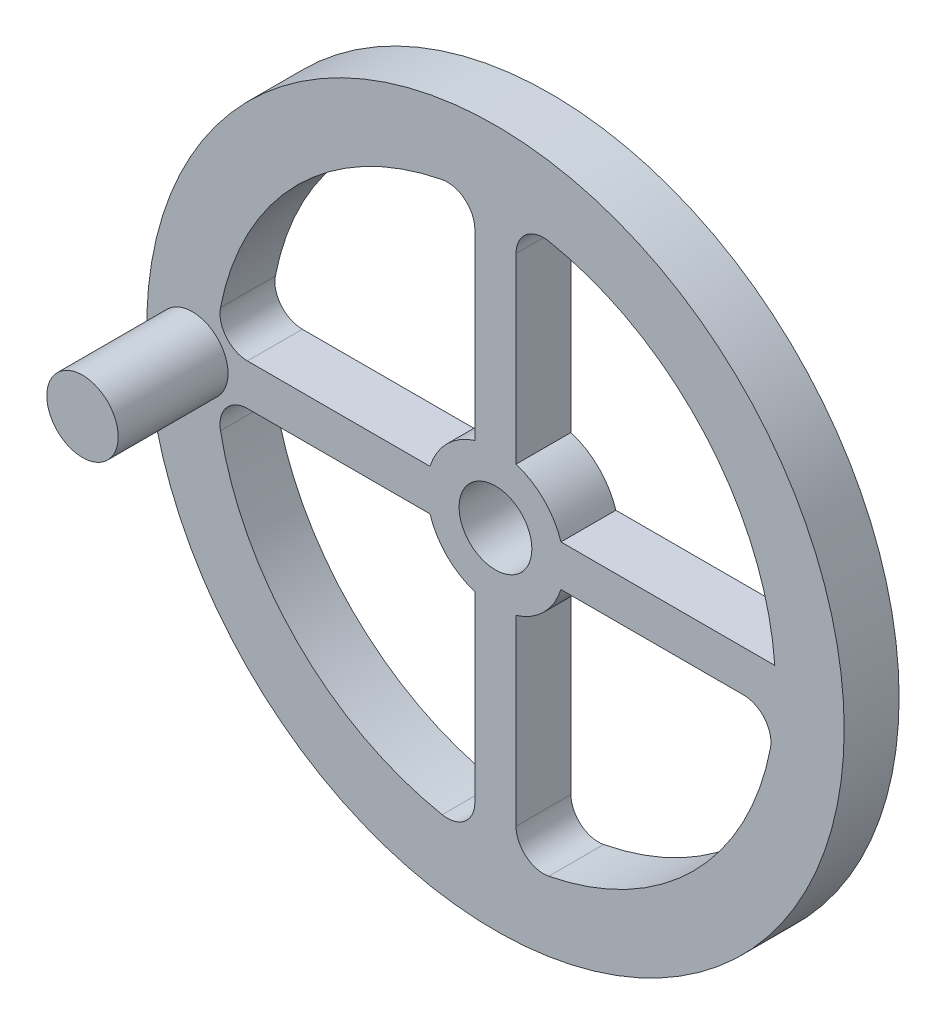
from build123d import *

# Parameters (mm, degrees)
SKETCH1_R           = 25.4
SKETCH1_R_2         = 2.65
BOSS_EXTRUDE1_DEPTH = 4
SKETCH2_R           = 2.6
BOSS_EXTRUDE2_DEPTH = 8


with BuildPart() as part:
    # Sketch1 → Boss-Extrude1 (new body)
    with BuildSketch(Plane.XY):
        with Locations((665.153160016, -1258.036738659)):
            Circle(SKETCH1_R)
        with Locations((665.153160016, -1258.036738659)):
            Circle(SKETCH1_R_2, mode=Mode.SUBTRACT)
        with BuildLine():
            Line((660.383464009, -1256.536738659), (647.089107314, -1256.536738659))
            ThreePointArc((647.089107314, -1256.536738659), (645.546241545, -1255.809360055), (645.125623325, -1254.156303877))
            ThreePointArc((645.125623325, -1254.156303877), (650.728181679, -1243.611760323), (661.272725233, -1238.009201969))
            ThreePointArc((661.272725233, -1238.009201969), (662.925781412, -1238.429820188), (663.653160016, -1239.972685958))
            Line((663.653160016, -1239.972685958), (663.653160016, -1253.267042652))
            ThreePointArc((663.653160016, -1253.267042652), (661.61762611, -1254.501204753), (660.383464009, -1256.536738659))
        make_face(mode=Mode.SUBTRACT)
        with BuildLine():
            Line((666.653160016, -1239.972685958), (666.653160016, -1253.267042652))
            ThreePointArc((666.653160016, -1253.267042652), (668.688693922, -1254.501204753), (669.922856023, -1256.536738659))
            Line((669.922856023, -1256.536738659), (685.497938215, -1256.536738659))
            ThreePointArc((685.497938215, -1256.536738659), (680.402180967, -1244.485821346), (669.033594798, -1238.009201969))
            ThreePointArc((669.033594798, -1238.009201969), (667.38053862, -1238.429820188), (666.653160016, -1239.972685958))
        make_face(mode=Mode.SUBTRACT)
        with BuildLine():
            Line((683.217212717, -1259.536738659), (669.922856023, -1259.536738659))
            ThreePointArc((669.922856023, -1259.536738659), (668.688693922, -1261.572272565), (666.653160016, -1262.806434666))
            Line((666.653160016, -1262.806434666), (666.653160016, -1276.100791361))
            ThreePointArc((666.653160016, -1276.100791361), (667.38053862, -1277.64365713), (669.033594798, -1278.06427535))
            ThreePointArc((669.033594798, -1278.06427535), (679.578138352, -1272.461716995), (685.180696706, -1261.917173442))
            ThreePointArc((685.180696706, -1261.917173442), (684.760078487, -1260.264117263), (683.217212717, -1259.536738659))
        make_face(mode=Mode.SUBTRACT)
        with BuildLine():
            Line((663.653160016, -1262.806434666), (663.653160016, -1276.100791361))
            ThreePointArc((663.653160016, -1276.100791361), (662.925781412, -1277.64365713), (661.272725233, -1278.06427535))
            ThreePointArc((661.272725233, -1278.06427535), (650.728181679, -1272.461716995), (645.125623325, -1261.917173442))
            ThreePointArc((645.125623325, -1261.917173442), (645.546241545, -1260.264117263), (647.089107314, -1259.536738659))
            Line((647.089107314, -1259.536738659), (660.383464009, -1259.536738659))
            ThreePointArc((660.383464009, -1259.536738659), (661.61762611, -1261.572272565), (663.653160016, -1262.806434666))
        make_face(mode=Mode.SUBTRACT)
    extrude(amount=BOSS_EXTRUDE1_DEPTH)

    # Sketch2 → Boss-Extrude2 (add)
    with BuildSketch(Plane.XY.offset(4)):
        with Locations((643.076644819, -1258.036738659)):
            Circle(SKETCH2_R)
    extrude(amount=BOSS_EXTRUDE2_DEPTH)


solid = part.part
